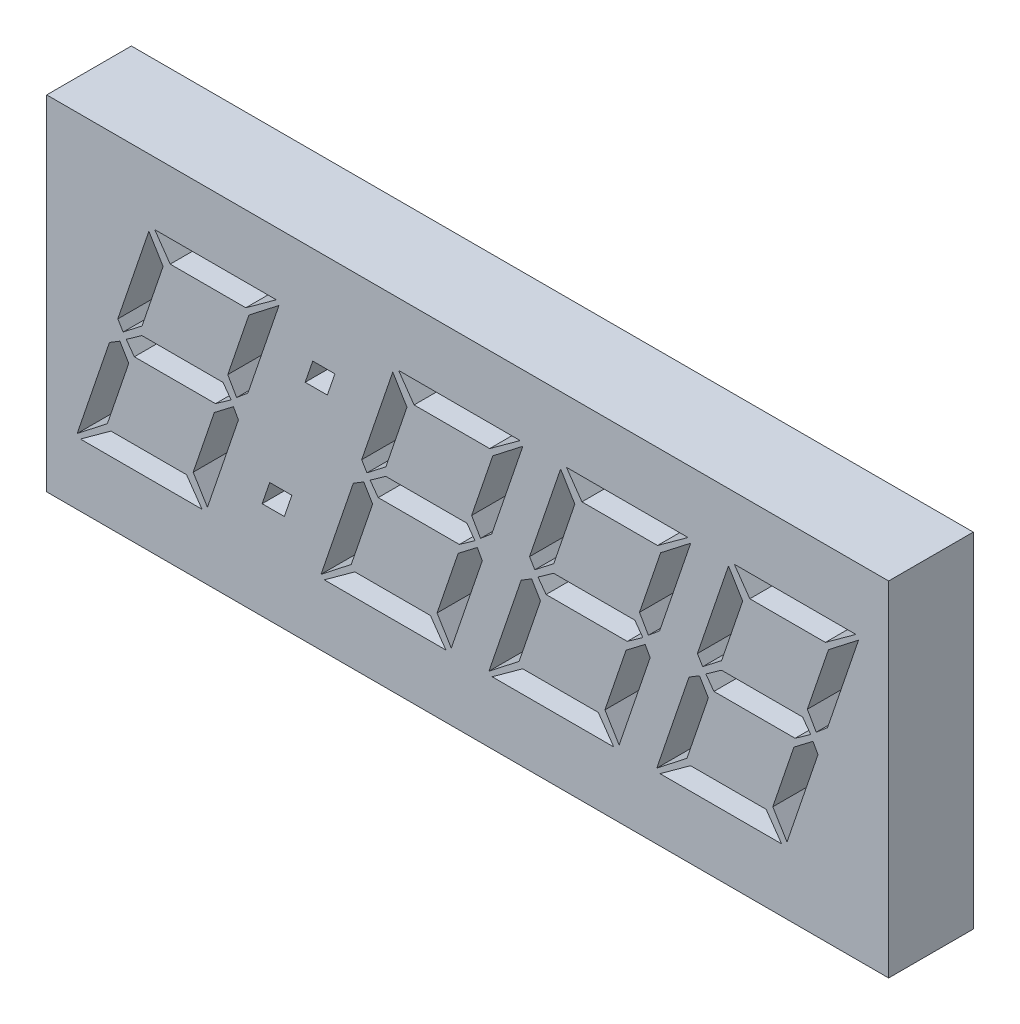
from build123d import *

# Parameters (mm, degrees)
SKETCH_1_W            = 500
SKETCH_1_H            = 220
EXTRUDE_1_DEPTH       = 50
CUT_EXTRUDE_1_DEPTH   = 65
SKETCH_3_W            = 24.993501938
SKETCH_3_H            = 24.754329671
EXTRUDE_2_DEPTH       = 50
SKETCH_4_W            = 557.488309353
SKETCH_4_H            = 263.064748201
SKETCH_4_W_2          = 497.488309353
SKETCH_4_H_2          = 203.064748201
CUT_EXTRUDE_1_2_DEPTH = 84


with BuildPart() as part:
    # Эскиз1 → Бобышка-Вытянуть1 (new body)
    with BuildSketch(Plane.XY):
        with Locations((315.178539616, -203.237931197)):
            Rectangle(SKETCH_1_W, SKETCH_1_H)
        Polygon((203.546220768, -131.339893042), (185.513397027, -144.433418222), (140.884350264, -144.433418222), (131.736418609, -131.339893042), align=None, mode=Mode.SUBTRACT)
        Polygon((159.677066091, -260.404641243), (87.867263933, -260.404641243), (105.900087674, -247.311116064), (150.529134437, -247.311116064), align=None, mode=Mode.SUBTRACT)
        Polygon((116.392443789, -207.416781531), (103.766544509, -244.593040524), (85.938307098, -258.534137646), (104.994062494, -202.419029733), (111.160879041, -198.678022538), align=None, mode=Mode.SUBTRACT)
        Polygon((109.933361055, -187.922626855), (128.287677602, -133.911835488), (136.67571717, -147.706799517), (124.225177602, -184.41543261), (113.060609257, -193.066511747), align=None, mode=Mode.SUBTRACT)
        Polygon((181.158630839, -203.997267143), (162.86276753, -257.832698797), (154.445501343, -244.066961387), (166.92526753, -207.299875056), (178.20674235, -198.678022538), align=None, mode=Mode.SUBTRACT)
        Polygon((174.874907818, -183.947806711), (187.354674005, -147.239173618), (205.124458178, -133.444209589), (186.770141631, -187.455000956), (180.106472566, -193.066511747), align=None, mode=Mode.SUBTRACT)
        Polygon((172.098379041, -189.325504553), (176.833091271, -195.872267143), (167.626706379, -202.419029733), (119.695051703, -202.419029733), (114.931112854, -195.872267143), (124.166724365, -189.325504553), align=None, mode=Mode.SUBTRACT)
        Polygon((188.173019329, -260.404641243), (192.615465372, -247.311116064), (205.708990552, -247.311116064), (201.266544509, -260.404641243), align=None, mode=Mode.SUBTRACT)
        Polygon((220.585339473, -165.00895779), (225.057012134, -151.91543261), (238.150537314, -151.91543261), (233.678864652, -165.00895779), align=None, mode=Mode.SUBTRACT)
        Polygon((347.574997746, -131.339893042), (329.542174005, -144.433418222), (284.913127242, -144.433418222), (275.765195588, -131.339893042), align=None, mode=Mode.SUBTRACT)
        Polygon((303.70584307, -260.404641243), (231.896040911, -260.404641243), (249.928864652, -247.311116064), (294.557911415, -247.311116064), align=None, mode=Mode.SUBTRACT)
        Polygon((260.421220768, -207.416781531), (247.795321487, -244.593040524), (229.967084077, -258.534137646), (249.022839473, -202.419029733), (255.189656019, -198.678022538), align=None, mode=Mode.SUBTRACT)
        Polygon((253.962138034, -187.922626855), (272.31645458, -133.911835488), (280.704494149, -147.706799517), (268.25395458, -184.41543261), (257.089386235, -193.066511747), align=None, mode=Mode.SUBTRACT)
        Polygon((325.187407818, -203.997267143), (306.891544509, -257.832698797), (298.474278321, -244.066961387), (310.954044509, -207.299875056), (322.235519329, -198.678022538), align=None, mode=Mode.SUBTRACT)
        Polygon((318.903684796, -183.947806711), (331.383450983, -147.239173618), (349.153235156, -133.444209589), (330.798918609, -187.455000956), (324.135249545, -193.066511747), align=None, mode=Mode.SUBTRACT)
        Polygon((316.127156019, -189.325504553), (320.86186825, -195.872267143), (311.655483357, -202.419029733), (263.723828681, -202.419029733), (258.959889832, -195.872267143), (268.195501343, -189.325504553), align=None, mode=Mode.SUBTRACT)
        Polygon((446.711688393, -131.339893042), (428.678864652, -144.433418222), (384.04981789, -144.433418222), (374.901886235, -131.339893042), align=None, mode=Mode.SUBTRACT)
        Polygon((402.842533717, -260.404641243), (331.032731559, -260.404641243), (349.0655553, -247.311116064), (393.694602063, -247.311116064), align=None, mode=Mode.SUBTRACT)
        Polygon((359.557911415, -207.416781531), (346.932012134, -244.593040524), (329.103774724, -258.534137646), (348.15953012, -202.419029733), (354.326346667, -198.678022538), align=None, mode=Mode.SUBTRACT)
        Polygon((353.098828681, -187.922626855), (371.453145228, -133.911835488), (379.841184796, -147.706799517), (367.390645228, -184.41543261), (356.226076883, -193.066511747), align=None, mode=Mode.SUBTRACT)
        Polygon((424.324098465, -203.997267143), (406.028235156, -257.832698797), (397.610968969, -244.066961387), (410.090735156, -207.299875056), (421.372209976, -198.678022538), align=None, mode=Mode.SUBTRACT)
        Polygon((418.040375444, -183.947806711), (430.520141631, -147.239173618), (448.289925804, -133.444209589), (429.935609257, -187.455000956), (423.271940192, -193.066511747), align=None, mode=Mode.SUBTRACT)
        Polygon((415.263846667, -189.325504553), (419.998558897, -195.872267143), (410.792174005, -202.419029733), (362.860519329, -202.419029733), (358.09658048, -195.872267143), (367.332191991, -189.325504553), align=None, mode=Mode.SUBTRACT)
        Polygon((545.848379041, -131.339893042), (527.8155553, -144.433418222), (483.186508537, -144.433418222), (474.038576883, -131.339893042), align=None, mode=Mode.SUBTRACT)
        Polygon((501.979224365, -260.404641243), (430.169422206, -260.404641243), (448.202245947, -247.311116064), (492.83129271, -247.311116064), align=None, mode=Mode.SUBTRACT)
        Polygon((458.694602063, -207.416781531), (446.068702782, -244.593040524), (428.240465372, -258.534137646), (447.296220768, -202.419029733), (453.463037314, -198.678022538), align=None, mode=Mode.SUBTRACT)
        Polygon((452.235519329, -187.922626855), (470.589835875, -133.911835488), (478.977875444, -147.706799517), (466.527335875, -184.41543261), (455.36276753, -193.066511747), align=None, mode=Mode.SUBTRACT)
        Polygon((523.460789113, -203.997267143), (505.164925804, -257.832698797), (496.747659616, -244.066961387), (509.227425804, -207.299875056), (520.508900624, -198.678022538), align=None, mode=Mode.SUBTRACT)
        Polygon((517.177066091, -183.947806711), (529.656832278, -147.239173618), (547.426616451, -133.444209589), (529.072299904, -187.455000956), (522.408630839, -193.066511747), align=None, mode=Mode.SUBTRACT)
        Polygon((514.400537314, -189.325504553), (519.135249545, -195.872267143), (509.928864652, -202.419029733), (461.997209976, -202.419029733), (457.233271127, -195.872267143), (466.468882638, -189.325504553), align=None, mode=Mode.SUBTRACT)
    extrude(amount=EXTRUDE_1_DEPTH)

    # Эскиз2 → Cut-Extrude 1 (cut)
    with BuildSketch(Plane.XY.offset(50)):
        Polygon((225.057012134, -151.91543261), (238.150537314, -151.91543261), (233.678864652, -165.00895779), (220.585339473, -165.00895779), align=None)
        Polygon((199.643902872, -226.731116064), (212.737428052, -226.731116064), (208.26575539, -239.824641243), (195.17223021, -239.824641243), align=None)
    extrude(amount=-CUT_EXTRUDE_1_DEPTH, mode=Mode.SUBTRACT)

    # Эскиз3 → Бобышка-Вытянуть2 (add)
    with BuildSketch(Plane.XY.offset(50)):
        with Locations((196.457377331, -256.289777907)):
            Rectangle(SKETCH_3_W, SKETCH_3_H)
    extrude(amount=-EXTRUDE_2_DEPTH)

    # Эскиз4 → Cut-Extrude 1 2 (cut)
    with BuildSketch(Plane.XY.offset(50)):
        with Locations((316.682461775, -195.872267142)):
            Rectangle(SKETCH_4_W, SKETCH_4_H)
        with Locations((316.682461775, -195.872267142)):
            Rectangle(SKETCH_4_W_2, SKETCH_4_H_2, mode=Mode.SUBTRACT)
    extrude(amount=-CUT_EXTRUDE_1_2_DEPTH, mode=Mode.SUBTRACT)


solid = part.part
